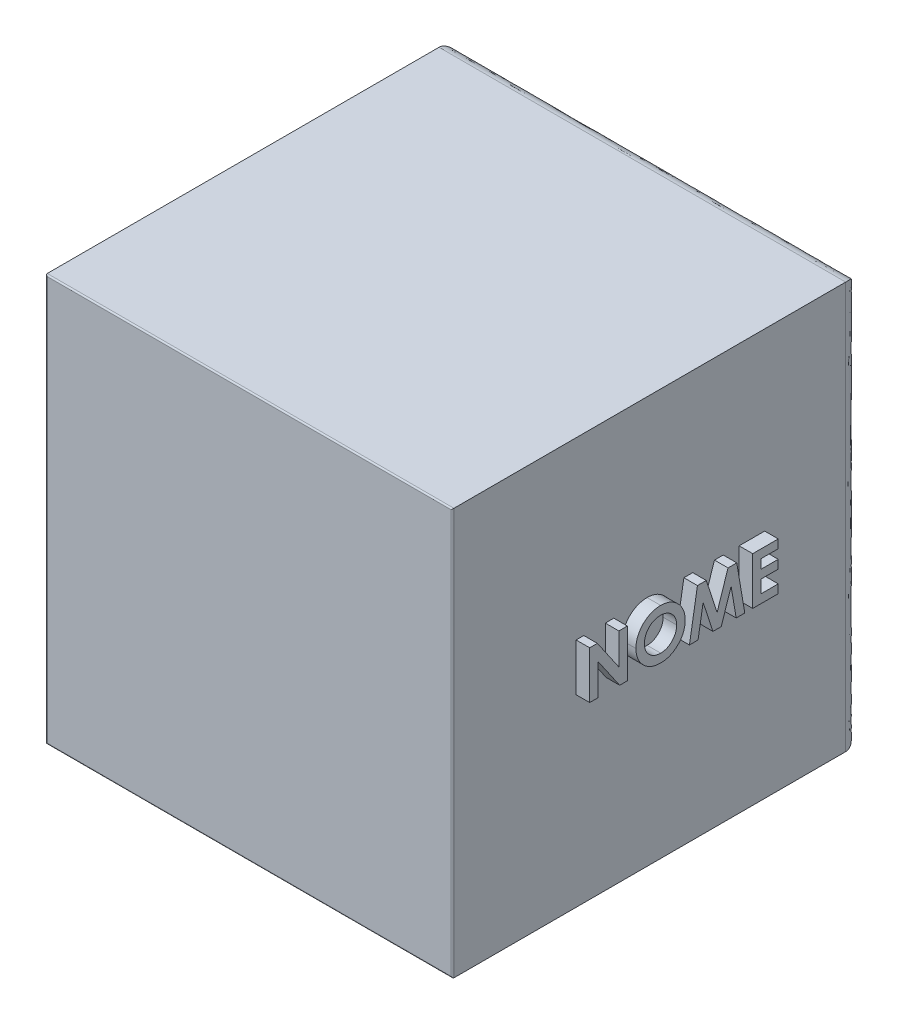
from build123d import *
from OCP.BRepFilletAPI import BRepFilletAPI_MakeFillet

# Parameters (mm, degrees)
ESBO_O1_W                = 30
ESBO_O1_H                = 30
RESSALTO_EXTRUS_O1_DEPTH = 30
ESBO_O2_W                = 28
ESBO_O2_H                = 28
CORTE_EXTRUS_O1_DEPTH    = 28
FILETE_VARI_VEL3_R       = 1
FILETE_START             = -16
FILETE_VARI_VEL5_DEPTH   = 32
FILETE_VARI_VEL5_2_DEPTH = 32
RESSALTO_EXTRUS_O2_DEPTH = 1
RESSALTO_EXTRUS_O3_DEPTH = 1
FILETE6_R1               = 0.5
FILETE6_R2               = 0.05


with BuildPart() as part:
    # Esboço1 → Ressalto-extrusão1 (new body)
    with BuildSketch(Plane.XY):
        Rectangle(ESBO_O1_W, ESBO_O1_H)
    extrude(amount=RESSALTO_EXTRUS_O1_DEPTH)

    # Esboço2 → Corte-extrusão1 (cut)
    with BuildSketch(Plane(origin=(0, 0, 0), x_dir=(-1, 0, 0), z_dir=(0, 0, -1))):
        Rectangle(ESBO_O2_W, ESBO_O2_H)
    extrude(amount=-CORTE_EXTRUS_O1_DEPTH, mode=Mode.SUBTRACT)

    # Filete variável3
    filete_vari_vel3_edges = [part.edges().sort_by_distance(p)[0] for p in [
        (0, 15, 0),
        (15, 0, 0),
        (0, -15, 0),
        (-15, 0, 0),
    ]]
    fillet(filete_vari_vel3_edges, radius=FILETE_VARI_VEL3_R - 0.0001)  # a hair under: the kernel refuses the full size

    # Filete variável5: read off the stored shape, not the designer's step
    # Filete variável5 outline → Filete variável5 (cut)
    with BuildSketch(Plane(origin=(0, 0, 0), x_dir=(1, 0, 0), z_dir=(0, 1, 0)).offset(FILETE_START)):
        with BuildLine():
            Line((-15, -30), (-14.9, -30))
            add(Edge.make_bspline(
                [(-14.9, -30), (-15, -30), (-15, -29.9)],
                knots=[0, 0, 0, 1, 1, 1], degree=2, weights=[1, 0.707106781, 1]))
            Line((-15, -29.9), (-15, -30))
        make_face()
        with BuildLine():
            add(Edge.make_bspline(
                [(14.9, -30), (15, -30), (15, -29.9)],
                knots=[0, 0, 0, 1, 1, 1], degree=2, weights=[1, 0.707106781, 1]))
            Line((14.9, -30), (15, -30))
            Line((15, -30), (15, -29.9))
        make_face()
    extrude(amount=FILETE_VARI_VEL5_DEPTH, mode=Mode.SUBTRACT)

    # Filete vari_vel5 2 outline → Filete vari_vel5 2 (cut)
    with BuildSketch(Plane.YZ.offset(FILETE_START)):
        with BuildLine():
            Line((15, 30), (14.9, 30))
            add(Edge.make_bspline(
                [(14.9, 30), (15, 30), (15, 29.9)],
                knots=[0, 0, 0, 1, 1, 1], degree=2, weights=[1, 0.707106781, 1]))
            Line((15, 29.9), (15, 30))
        make_face()
        with BuildLine():
            add(Edge.make_bspline(
                [(-14.9, 30), (-15, 30), (-15, 29.9)],
                knots=[0, 0, 0, 1, 1, 1], degree=2, weights=[1, 0.707106781, 1]))
            Line((-14.9, 30), (-15, 30))
            Line((-15, 30), (-15, 29.9))
        make_face()
    extrude(amount=FILETE_VARI_VEL5_2_DEPTH, mode=Mode.SUBTRACT)

    # Esboço8 → Ressalto-extrusão2 (add)
    with BuildSketch(Plane.XZ.offset(15)):
        with BuildLine():
            Line((4.414863795, 15.32898241), (0, 8.201983522))
            Line((0, 8.201983522), (-4.415366232, 15.327957657))
            add(Edge.make_bspline(
                [(4.414863795, 15.32898241), (-0.000251218, 24.333396226), (-4.415366232, 15.327957657)],
                knots=[0, 0, 0, 1, 1, 1], degree=2))
        make_face()
    extrude(amount=RESSALTO_EXTRUS_O2_DEPTH)

    # Esboço11 → Ressalto-extrusão3 (add)
    # profile 1 of 4: a face of its own
    with BuildSketch(Plane(origin=(15, 0, 0), x_dir=(0, 0, -1), z_dir=(1, 0, 0))):
        Polygon((-20.886766456, 2.080779966), (-20.320961168, 2.080779966), (-18.732920302, -0.22240513), (-18.732920302, 2.080779966), (-18.104715174, 2.080779966), (-18.104715174, -1.419220034), (-18.674727193, -1.419220034), (-20.258561328, 0.876953844), (-20.258561328, -1.419220034), (-20.886766456, -1.419220034), align=None)
    # profile 2 of 4: a face of its own
    with BuildSketch(Plane(origin=(15, 0, 0), x_dir=(0, 0, -1), z_dir=(1, 0, 0))):
        with BuildLine():
            add(Edge.make_bspline(
                [(-15.652191136, 2.170523556), (-15.591339346, 2.168947994), (-15.471204131, 2.165837478), (-15.294528582, 2.139908901), (-15.124269023, 2.097662001), (-14.960502446, 2.038935756), (-14.803638902, 1.962139558), (-14.653125082, 1.869450631), (-14.509500119, 1.759119527), (-14.374235767, 1.633720089), (-14.24922711, 1.497353676), (-14.140907036, 1.350530988), (-14.04853565, 1.197056348), (-13.971977999, 1.036518518), (-13.913665097, 0.867805695), (-13.872744523, 0.691778092), (-13.846455081, 0.508485788), (-13.84343139, 0.383688712), (-13.841894661, 0.320263139)],
                knots=[0, 0, 0, 0, 1.014329547, 2.002516266, 2.970391464, 3.935626869, 4.897733899, 5.877609409, 6.878433252, 7.912639331, 8.949961323, 9.958554974, 10.949718813, 11.932905612, 12.9188844, 13.919928257, 14.942845884, 16, 16, 16, 16], degree=3))
            add(Edge.make_bspline(
                [(-13.841894661, 0.320263139), (-13.843531211, 0.257552226), (-13.846756085, 0.133978359), (-13.871671273, -0.047624834), (-13.913280955, -0.221766814), (-13.970604824, -0.388841756), (-14.045774009, -0.548040405), (-14.136344052, -0.700379222), (-14.244704924, -0.844444468), (-14.366904278, -0.98015883), (-14.501435163, -1.103348736), (-14.643924726, -1.211909627), (-14.793715039, -1.303900029), (-14.950586857, -1.379277807), (-15.114876583, -1.437775724), (-15.286178403, -1.479050255), (-15.464481715, -1.504133621), (-15.585736615, -1.507337431), (-15.647283283, -1.508963624)],
                knots=[0, 0, 0, 0, 1.051557043, 2.072126891, 3.067553643, 4.050577992, 5.02905126, 6.015227836, 7.017913613, 8.04756643, 9.074058332, 10.072836633, 11.047628519, 12.017157415, 12.98668631, 13.966869689, 14.968021931, 16, 16, 16, 16], degree=3))
            add(Edge.make_bspline(
                [(-15.647283283, -1.508963624), (-15.711653718, -1.507504849), (-15.838132825, -1.504638556), (-16.023235564, -1.477381416), (-16.200579982, -1.436322643), (-16.368676284, -1.375044626), (-16.529236387, -1.298441952), (-16.681080609, -1.204101167), (-16.82415792, -1.092178176), (-16.957647606, -0.965539368), (-17.078589584, -0.826968736), (-17.185344603, -0.680581151), (-17.275394829, -0.527494887), (-17.348743558, -0.367638295), (-17.40656875, -0.202004845), (-17.447357852, -0.029585782), (-17.471452949, 0.149205371), (-17.474809256, 0.270643897), (-17.476510046, 0.33218221)],
                knots=[0, 0, 0, 0, 1.067978421, 2.098431617, 3.099715153, 4.085208694, 5.062210972, 6.048429807, 7.046490867, 8.072918869, 9.098532598, 10.095778865, 11.076610158, 12.041847152, 13.011192615, 13.984257998, 14.978533688, 16, 16, 16, 16], degree=3))
            add(Edge.make_bspline(
                [(-17.476510046, 0.33218221), (-17.47597624, 0.373581965), (-17.474915387, 0.45585726), (-17.462136298, 0.577785048), (-17.443738084, 0.697332969), (-17.416527998, 0.814024384), (-17.383474699, 0.928682497), (-17.34064948, 1.040240041), (-17.291902791, 1.149888758), (-17.234946876, 1.256333559), (-17.171617404, 1.358595064), (-17.102519313, 1.456190886), (-17.027478855, 1.54794095), (-16.946737761, 1.634448199), (-16.860017785, 1.715144015), (-16.768459641, 1.791170759), (-16.670287632, 1.860508891), (-16.567650436, 1.924851786), (-16.461126698, 1.983035951), (-16.351150066, 2.032560571), (-16.239986276, 2.075809579), (-16.12615033, 2.109943608), (-16.010862182, 2.137745418), (-15.892890212, 2.156131232), (-15.77330023, 2.168909967), (-15.692656639, 2.169984416), (-15.652191136, 2.170523556)],
                knots=[0, 0, 0, 0, 1.034744296, 2.056386356, 3.06226378, 4.057406941, 5.050368692, 6.043467995, 7.042652155, 8.049140477, 9.059438543, 10.048523776, 11.036952808, 12.020949711, 13.004946614, 13.997082645, 14.994316842, 16.007702937, 17.024872941, 18.026463647, 19.021641123, 20.005082605, 20.995858141, 21.984425357, 22.988620895, 24, 24, 24, 24], degree=3))
        make_face()
        with BuildLine():
            add(Edge.make_bspline(
                [(-15.662006841, 1.542318428), (-15.702960087, 1.54121956), (-15.783785407, 1.539050835), (-15.902341432, 1.522528086), (-16.016159403, 1.496139376), (-16.124608382, 1.457915653), (-16.228158395, 1.409266554), (-16.326993006, 1.350362066), (-16.419743559, 1.279177413), (-16.507646794, 1.199534182), (-16.587052901, 1.110793318), (-16.657210702, 1.015692391), (-16.715921481, 0.914390218), (-16.765092127, 0.80782787), (-16.802106725, 0.694807084), (-16.828471114, 0.576213163), (-16.845132423, 0.451841764), (-16.847232602, 0.367057944), (-16.848304918, 0.323768748)],
                knots=[0, 0, 0, 0, 1.033739768, 2.040188636, 3.016340934, 3.979330865, 4.937572243, 5.900995986, 6.878200029, 7.884839167, 8.891893314, 9.879764717, 10.863503415, 11.843163062, 12.837761627, 13.859916423, 14.907309254, 16, 16, 16, 16], degree=3))
            add(Edge.make_bspline(
                [(-16.848304918, 0.323768748), (-16.84688319, 0.275794582), (-16.84409684, 0.181773165), (-16.824491743, 0.044617255), (-16.790949373, -0.08491289), (-16.742514843, -0.206183756), (-16.682443318, -0.320541966), (-16.607844019, -0.426585897), (-16.5199251, -0.524950492), (-16.452193078, -0.582379839), (-16.417816136, -0.611527726)],
                knots=[0, 0, 0, 0, 1.078454662, 2.113592447, 3.107694534, 4.079536787, 5.043276885, 6.005368276, 6.987637804, 8, 8, 8, 8], degree=3))
            add(Edge.make_bspline(
                [(-16.417816136, -0.611527726), (-16.389654857, -0.633061066), (-16.333966778, -0.675642595), (-16.245076481, -0.73021956), (-16.153536977, -0.776997463), (-16.058657488, -0.814793455), (-15.960638393, -0.844523148), (-15.859493135, -0.865342363), (-15.755365026, -0.87840822), (-15.68494872, -0.879969838), (-15.649386648, -0.880758495)],
                knots=[0, 0, 0, 0, 1.023928204, 2.024787132, 3.009472467, 3.9914905, 4.972207045, 5.96565515, 6.972602802, 8, 8, 8, 8], degree=3))
            add(Edge.make_bspline(
                [(-15.649386648, -0.880758495), (-15.609137594, -0.879650311), (-15.529946314, -0.877469922), (-15.413597274, -0.861150577), (-15.302131359, -0.833532352), (-15.19485658, -0.79564394), (-15.09208227, -0.74638401), (-14.994310715, -0.68565249), (-14.901370494, -0.614195084), (-14.813579247, -0.533505963), (-14.733333898, -0.444415522), (-14.663322502, -0.348807336), (-14.602745013, -0.24878794), (-14.554596872, -0.142941712), (-14.516119911, -0.032267789), (-14.490072831, 0.083723979), (-14.473270772, 0.204555429), (-14.471170001, 0.286785502), (-14.47009979, 0.328676601)],
                knots=[0, 0, 0, 0, 1.026359118, 2.019393844, 2.989460624, 3.950973911, 4.916101784, 5.890408035, 6.881132271, 7.902007068, 8.92769091, 9.933912415, 10.920395702, 11.90457117, 12.894218921, 13.903490204, 14.931958862, 16, 16, 16, 16], degree=3))
            add(Edge.make_bspline(
                [(-14.47009979, 0.328676601), (-14.471207031, 0.370326815), (-14.473386466, 0.452308909), (-14.489734535, 0.572829703), (-14.517177612, 0.688309401), (-14.555179798, 0.798936594), (-14.603706578, 0.904819737), (-14.663714863, 1.005586483), (-14.734994093, 1.101139415), (-14.815903781, 1.190827376), (-14.903969003, 1.273244868), (-14.998515819, 1.344768268), (-15.096898701, 1.406919829), (-15.201375035, 1.455606852), (-15.30980732, 1.494395701), (-15.422857217, 1.522960365), (-15.540952909, 1.538934762), (-15.621295851, 1.541180486), (-15.662006841, 1.542318428)],
                knots=[0, 0, 0, 0, 1.055025985, 2.07665775, 3.074803781, 4.057872707, 5.035505728, 6.020516407, 7.023567878, 8.050795229, 9.077271434, 10.074415901, 11.050397877, 12.019801805, 12.988065821, 13.964604439, 14.968634123, 16, 16, 16, 16], degree=3))
        make_face(mode=Mode.SUBTRACT)
    # profile 3 of 4: a face of its own
    with BuildSketch(Plane(origin=(15, 0, 0), x_dir=(0, 0, -1), z_dir=(1, 0, 0))):
        Polygon((-12.936746424, 2.080779966), (-12.284703155, 2.080779966), (-11.486125431, -0.360526124), (-10.681938732, 2.080779966), (-10.036205559, 2.080779966), (-9.444458764, -1.419220034), (-10.080376232, -1.419220034), (-10.454074148, 0.791416985), (-11.181838572, -1.419220034), (-11.79461902, -1.419220034), (-12.518176713, 0.791416985), (-12.891173507, -1.419220034), (-13.527792097, -1.419220034), align=None)
    # profile 4 of 4: a face of its own
    with BuildSketch(Plane(origin=(15, 0, 0), x_dir=(0, 0, -1), z_dir=(1, 0, 0))):
        Polygon((-8.861125431, 2.080779966), (-6.976510046, 2.080779966), (-6.976510046, 1.452574838), (-8.232920302, 1.452574838), (-8.232920302, 0.779497915), (-6.976510046, 0.779497915), (-6.976510046, 0.151292787), (-8.232920302, 0.151292787), (-8.232920302, -0.791014906), (-6.976510046, -0.791014906), (-6.976510046, -1.419220034), (-8.861125431, -1.419220034), align=None)
    extrude(amount=RESSALTO_EXTRUS_O3_DEPTH)

    # Filete6: one fillet with a radius per group of edges: ONE call of the kernel's fillet builder (fillet() takes one radius for all edges)
    filete6_edges_1 = [part.edges().sort_by_distance(p)[0] for p in [
        (-4.415366232, -15.5, 15.327957657),
        (4.414863795, -15.5, 15.32898241),
    ]]
    filete6_edges_2 = [part.edges().sort_by_distance(p)[0] for p in [
        (0, -15.5, 8.201983522),
    ]]
    filete6 = BRepFilletAPI_MakeFillet(part.part.solid().wrapped)
    for e in filete6_edges_1:
        filete6.Add(FILETE6_R1, e.wrapped)
    for e in filete6_edges_2:
        filete6.Add(FILETE6_R2, e.wrapped)
    add(Compound.cast(filete6.Shape()), mode=Mode.REPLACE)


solid = part.part
